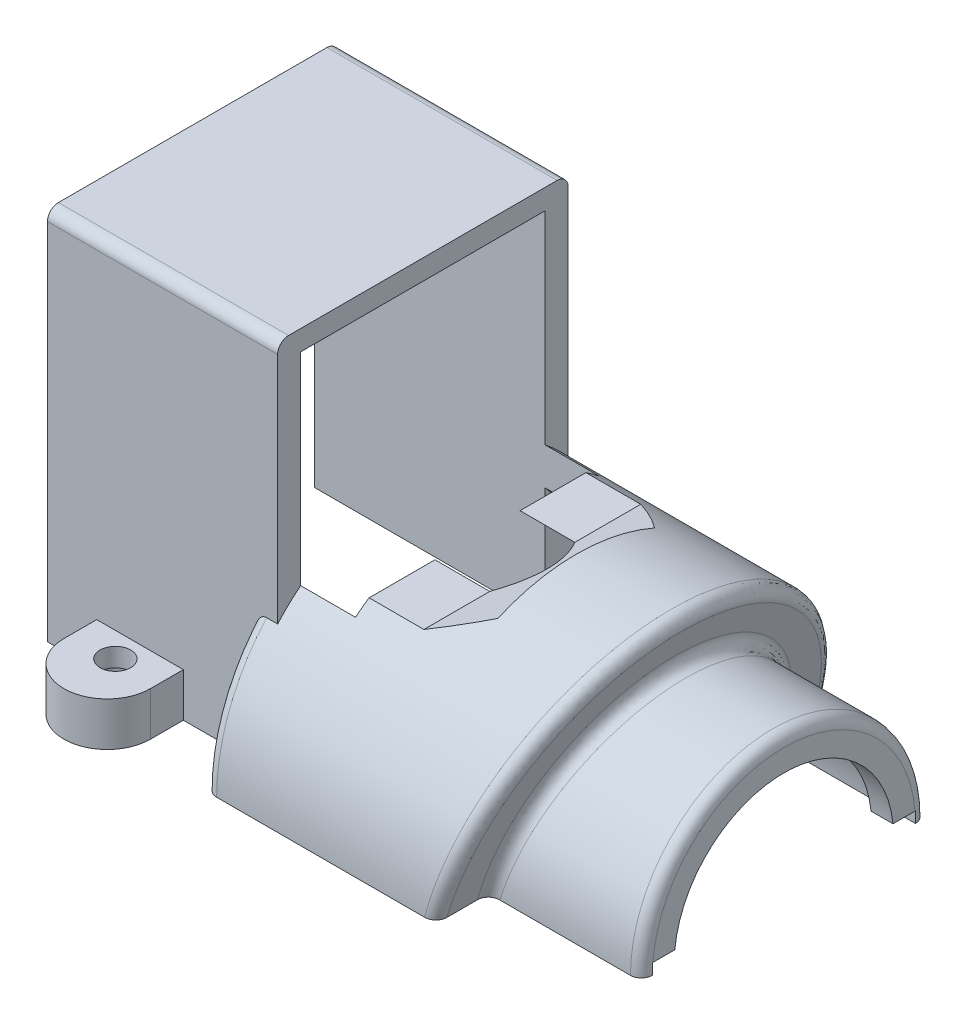
from build123d import *

# Parameters (mm, degrees)
ESQUISSE1_W                                       = 21.5
ESQUISSE1_H                                       = 34.2
EXTRUSION1_DEPTH                                  = 26.5
ESQUISSE2_W                                       = 22.27
ESQUISSE2_H                                       = 32.35
ENL_V_MAT_EXTRU_1_DEPTH                           = 49.312938226
EXTRUSION2_DEPTH                                  = 4
CHAMBRAGE_POUR_VIS_T_TE_HEXAGONALE_M2_D           = 2.8
CHAMBRAGE_POUR_VIS_T_TE_HEXAGONALE_M2_DEPTH       = 10.8185
CHAMBRAGE_POUR_VIS_T_TE_HEXAGONALE_M2_CBORE_D     = 5
CHAMBRAGE_POUR_VIS_T_TE_HEXAGONALE_M2_CBORE_DEPTH = 2.3
CHAMBRAGE_POUR_VIS_T_TE_HEXAGONALE_M2_TIP         = 0.841204867
CONG_1_R                                          = 1
EXTRUSION3_DEPTH                                  = 24
EXTRUSION3_DEPTH_BACK                             = 2
ENL_V_MAT_EXTRU_2_DEPTH                           = 24
ENL_V_MAT_EXTRU_3_DEPTH                           = 7
ENL_V_MAT_EXTRU_4_DEPTH                           = 67.021151914
ENL_V_MAT_EXTRU_5_DEPTH                           = 67.021151914
ENL_V_MAT_EXTRU_5_DEPTH_BACK                      = 67.021151914
EXTRUSION4_START                                  = -1
EXTRUSION4_DEPTH                                  = 5.297752809
EXTRUSION4_START_2                                = 38.99092925
EXTRUSION4_2_OUTLINE_W                            = 19
EXTRUSION4_2_OUTLINE_H                            = 34
EXTRUSION4_2_DEPTH                                = 5.00907075
EXTRUSION5_DEPTH                                  = 13.95
ENL_V_MAT_EXTRU_6_DEPTH                           = 13.95
CONG_4_R                                          = 1
EXTRUSION7_REACH                                  = 74.48
EXTRUSION7_END_RADIUS                             = 15.3
ESQUISSE15_R                                      = 2.5
EXTRUSION7_DIRECTION_2_DEPTH                      = 1.5
ESQUISSE16_R                                      = 1.15
ENL_V_MAT_EXTRU_7_DEPTH                           = 10
EXTRUSION9_DEPTH                                  = 2
EXTRUSION11_DEPTH                                 = 2
CONG_6_R                                          = 1
ENL_V_MAT_EXTRU_10_DEPTH                          = 1
ESQUISSE20_W                                      = 1.651458657
ESQUISSE20_H                                      = 29.200791705
ENL_V_MAT_EXTRU_11_DEPTH                          = 74.199692791


with BuildPart() as part:
    # Esquisse1 → Extrusion1 (new body)
    with BuildSketch(Plane.XY):
        with Locations((10.75, 17.1)):
            Rectangle(ESQUISSE1_W, ESQUISSE1_H)
    extrude(amount=EXTRUSION1_DEPTH)

    # Esquisse2 → Enlèv. mat.-Extru.1 (cut, through all)
    with BuildSketch(Plane.ZY):
        with Locations((13.265, 16.175)):
            Rectangle(ESQUISSE2_W, ESQUISSE2_H)
    extrude(amount=-ENL_V_MAT_EXTRU_1_DEPTH, mode=Mode.SUBTRACT)

    # Esquisse3 → Extrusion2 (add)
    with BuildSketch(Plane.XZ):
        with BuildLine():
            Line((12.9, 26.5), (5, 26.5))
            Line((5, 26.5), (5, 29.5))
            ThreePointArc((5, 29.5), (8.95, 33.45), (12.9, 29.5))
            Line((12.9, 29.5), (12.9, 26.5))
        make_face()
        with BuildLine():
            Line((12.9, 0.03), (5, 0.03))
            Line((5, 0.03), (5, -2.97))
            ThreePointArc((5, -2.97), (8.95, -6.92), (12.9, -2.97))
            Line((12.9, -2.97), (12.9, 0.03))
        make_face()
    extrude(amount=-EXTRUSION2_DEPTH)

    # Chambrage pour vis à tête hexagonale M2.51
    with Locations(Plane.XZ):
        with Locations((8.95, 28.75), (8.95, -2.25)):
            CounterBoreHole(CHAMBRAGE_POUR_VIS_T_TE_HEXAGONALE_M2_D / 2, CHAMBRAGE_POUR_VIS_T_TE_HEXAGONALE_M2_CBORE_D / 2, CHAMBRAGE_POUR_VIS_T_TE_HEXAGONALE_M2_CBORE_DEPTH, depth=CHAMBRAGE_POUR_VIS_T_TE_HEXAGONALE_M2_DEPTH)
            with Locations((0, 0, -(CHAMBRAGE_POUR_VIS_T_TE_HEXAGONALE_M2_DEPTH + CHAMBRAGE_POUR_VIS_T_TE_HEXAGONALE_M2_TIP / 2))):  # 118° drill point
                Cone(0, CHAMBRAGE_POUR_VIS_T_TE_HEXAGONALE_M2_D / 2, CHAMBRAGE_POUR_VIS_T_TE_HEXAGONALE_M2_TIP, mode=Mode.SUBTRACT)

    # Congé1
    cong_1_edges = [part.edges().sort_by_distance(p)[0] for p in [
        (10.75, 34.2, 26.5),
        (10.75, 34.2, 0),
    ]]
    fillet(cong_1_edges, radius=CONG_1_R)

    # Esquisse6 → Extrusion3 (add, two sides: drawn at the far end of the back side and taken through both)
    with BuildSketch(Plane(origin=(21.5, 0, 0), x_dir=(0, 0, -1), z_dir=(1, 0, 0)).offset(-EXTRUSION3_DEPTH_BACK)):
        with BuildLine():
            Line((-31.065, 0), (4.535, 0))
            ThreePointArc((4.535, 0), (-13.265, 17.8), (-31.065, 0))
        make_face()
    extrude(amount=EXTRUSION3_DEPTH + EXTRUSION3_DEPTH_BACK)

    # Esquisse7 → Enlèv. mat.-Extru.2 (cut)
    with BuildSketch(Plane(origin=(45.5, 0, 0), x_dir=(0, 0, -1), z_dir=(1, 0, 0))):
        with BuildLine():
            Line((-28.565, 0), (2.035, 0))
            ThreePointArc((2.035, 0), (-13.265, 15.3), (-28.565, 0))
        make_face()
    extrude(amount=-ENL_V_MAT_EXTRU_2_DEPTH, mode=Mode.SUBTRACT)

    # Esquisse8 → Enlèv. mat.-Extru.3 (cut)
    with BuildSketch(Plane.ZY.offset(-19.5)):
        with BuildLine():
            Line((2.13, 13.88710823), (2.13, 0))
            Line((2.13, 0), (24.4, 0))
            Line((24.4, 0), (24.4, 13.88710823))
            ThreePointArc((24.4, 13.88710823), (13.265, 17.8), (2.13, 13.88710823))
        make_face()
    extrude(amount=-ENL_V_MAT_EXTRU_3_DEPTH, mode=Mode.SUBTRACT)

    # Esquisse9 → Enlèv. mat.-Extru.4 (cut, through all)
    with BuildSketch(Plane.XY):
        Polygon((26.5, 14.8), (31.5, 14.8), (35.5, 16.3), (35.5, 17.8), (26.5, 17.8), align=None)
    extrude(amount=ENL_V_MAT_EXTRU_4_DEPTH, mode=Mode.SUBTRACT)

    # Esquisse10 → Enlèv. mat.-Extru.5 (cut, two sides: drawn at the far end of the back side and taken through both)
    with BuildSketch(Plane.XY.offset(-ENL_V_MAT_EXTRU_5_DEPTH_BACK)):
        Polygon((45.5, 17.8), (40.5, 0), (45.5, 0), align=None)
    extrude(amount=ENL_V_MAT_EXTRU_5_DEPTH + ENL_V_MAT_EXTRU_5_DEPTH_BACK, mode=Mode.SUBTRACT)

    # Extrusion4: read off the stored shape, not the designer's step
    # Extrusion4 outline → Extrusion4 (add)
    with BuildSketch(Plane(origin=(40.5, 0, 0), x_dir=(0, 0, -1), z_dir=(1, 0, 0)).offset(EXTRUSION4_START)):
        with BuildLine():
            Line((-28.565, 0), (-24.565, 0))
            ThreePointArc((-24.565, 0), (-13.265, 11.3), (-1.965, 0))
            Line((-1.965, 0), (2.035, 0))
            ThreePointArc((2.035, 0), (-13.265, 15.3), (-28.565, 0))
        make_face()
    extrude(amount=EXTRUSION4_DEPTH)

    # Extrusion4 2 outline → Extrusion4 2 (cut)
    with BuildSketch(Plane(origin=(0, 0, 0), x_dir=(0.270432301636311, 0.962738993825267, 0), z_dir=(0.962738993825267, -0.270432301636311, 0)).offset(EXTRUSION4_START_2)):
        with Locations((18.5, 13)):
            Rectangle(EXTRUSION4_2_OUTLINE_W, EXTRUSION4_2_OUTLINE_H)
    extrude(amount=EXTRUSION4_2_DEPTH, mode=Mode.SUBTRACT)

    # Esquisse12 → Extrusion5 (add)
    with BuildSketch(Plane(origin=(40.5, 9.905458384, 0), x_dir=(0, 0, -1), z_dir=(-1, 0, 0))):
        with BuildLine():
            Line((-26.265, 9.905458384), (-0.265, 9.905458384))
            ThreePointArc((-0.265, 9.905458384), (-13.265, -3.094541616), (-26.265, 9.905458384))
        make_face()
    extrude(amount=-EXTRUSION5_DEPTH)

    # Esquisse13 → Enlèv. mat.-Extru.6 (cut)
    with BuildSketch(Plane(origin=(54.45, 0, 0), x_dir=(0, 0, -1), z_dir=(1, 0, 0))):
        with BuildLine():
            Line((-24.265, 0), (-2.265, 0))
            ThreePointArc((-2.265, 0), (-13.265, 11), (-24.265, 0))
        make_face()
    extrude(amount=-ENL_V_MAT_EXTRU_6_DEPTH, mode=Mode.SUBTRACT)

    # Congé4
    cong_4_edges = [part.edges().sort_by_distance(p)[0] for p in [
        (19.5, 6.374048949, 29.884611909),
        (19.5, 6.353070124, -3.362642647),
    ]]
    fillet(cong_4_edges, radius=CONG_4_R)

    # Extrusion7: up to this cylinder (the profile starts inside it)
    extrusion7_end = Plane(origin=(31.65, 0, 13.265), z_dir=(1, 0, 0)) * Cylinder(EXTRUSION7_END_RADIUS, 180.56, mode=Mode.PRIVATE)
    # Esquisse15 → Extrusion7 (add, up to the surface)
    with BuildSketch(Plane.XZ, mode=Mode.PRIVATE) as extrusion7_sk1:
        with Locations(Location((31.65, 25.365, 0), (0, 0, 270))):
            Circle(ESQUISSE15_R)
    extrusion7_tool1 = extrude(extrusion7_sk1.sketch, amount=-EXTRUSION7_REACH, mode=Mode.PRIVATE) & extrusion7_end
    add(extrusion7_tool1.solids().sort_by_distance((31.65, 0, 25.365))[0])
    # Esquisse15 → Extrusion7 (add, up to the surface)
    with BuildSketch(Plane.XZ, mode=Mode.PRIVATE) as extrusion7_sk2:
        with Locations(Location((31.65, 1.165, 0), (0, 0, 270))):
            Circle(ESQUISSE15_R)
    extrusion7_tool2 = extrude(extrusion7_sk2.sketch, amount=-EXTRUSION7_REACH, mode=Mode.PRIVATE) & extrusion7_end
    add(extrusion7_tool2.solids().sort_by_distance((31.65, 0, 1.165))[0])

    # Esquisse15 → Extrusion7 direction 2 (add)
    with BuildSketch(Plane.XZ):
        with Locations(Location((31.65, 25.365, 0), (0, 0, 270))):
            Circle(ESQUISSE15_R)
        with Locations(Location((31.65, 1.165, 0), (0, 0, 270))):
            Circle(ESQUISSE15_R)
    extrude(amount=EXTRUSION7_DIRECTION_2_DEPTH)

    # Esquisse16 → Enlèv. mat.-Extru.7 (cut)
    with BuildSketch(Plane.XZ.offset(1.5)):
        with Locations(Location((31.65, 25.365, 0), (0, 0, 270))):
            Circle(ESQUISSE16_R)
        with Locations(Location((31.65, 1.165, 0), (0, 0, 270))):
            Circle(ESQUISSE16_R)
    extrude(amount=-ENL_V_MAT_EXTRU_7_DEPTH, mode=Mode.SUBTRACT)

    # Esquisse14 → Extrusion9 (add)
    with BuildSketch(Plane(origin=(54.45, 0, 0), x_dir=(0, 0, -1), z_dir=(1, 0, 0))):
        with BuildLine():
            ThreePointArc((-2.265, 0), (-13.265, 11), (-24.265, 0))
            Line((-24.265, 0), (-23.265, 0))
            ThreePointArc((-23.265, 0), (-13.265, 10), (-3.265, 0))
            Line((-3.265, 0), (-2.265, 0))
        make_face()
    extrude(amount=-EXTRUSION9_DEPTH)

    # Esquisse18 → Extrusion11 (add)
    with BuildSketch(Plane(origin=(39.5, 0, 0), x_dir=(0, 0, -1), z_dir=(1, 0, 0))):
        with BuildLine():
            Line((-3.265, 0), (-1.965, 0))
            ThreePointArc((-1.965, 0), (-13.265, 11.3), (-24.565, 0))
            Line((-24.565, 0), (-23.265, 0))
            ThreePointArc((-23.265, 0), (-13.265, 10), (-3.265, 0))
        make_face()
    extrude(amount=EXTRUSION11_DEPTH)

    # Congé6
    cong_6_edges = [part.edges().sort_by_distance(p)[0] for p in [
        (45.401286507, 17.448579966, 9.745474866),
        (44.151685393, 13, 13.265),
        (54.45, 13, 13.265),
    ]]
    fillet(cong_6_edges, radius=CONG_6_R)

    # Esquisse19 → Enlèv. mat.-Extru.10 (cut)
    with BuildSketch(Plane.XZ):
        Polygon((54.45, 1.265), (39.5, 1.265), (39.5, -3.55), (23.919264305, -3.55), (23.919264305, -2.55), (23.919264305, -1.335), (38.356428546, -1.335), (38.356428546, 4.29444057), (54.45, 4.29444057), align=None)
        Polygon((38.356428546, 22.23555943), (38.356428546, 27.865), (23.919264305, 27.865), (23.919264305, 29.08), (23.919264305, 30.08), (39.5, 30.08), (39.5, 25.265), (54.45, 25.265), (54.45, 22.23555943), align=None)
    extrude(amount=-ENL_V_MAT_EXTRU_10_DEPTH, mode=Mode.SUBTRACT)

    # Esquisse20 → Enlèv. mat.-Extru.11 (cut, through all)
    with BuildSketch(Plane(origin=(0, 34.2, 0), x_dir=(-1, 0, 0), z_dir=(0, 1, 0))):
        with Locations((0.325729329, 13.565265211)):
            Rectangle(ESQUISSE20_W, ESQUISSE20_H)
    extrude(amount=-ENL_V_MAT_EXTRU_11_DEPTH, mode=Mode.SUBTRACT)


solid = part.part
